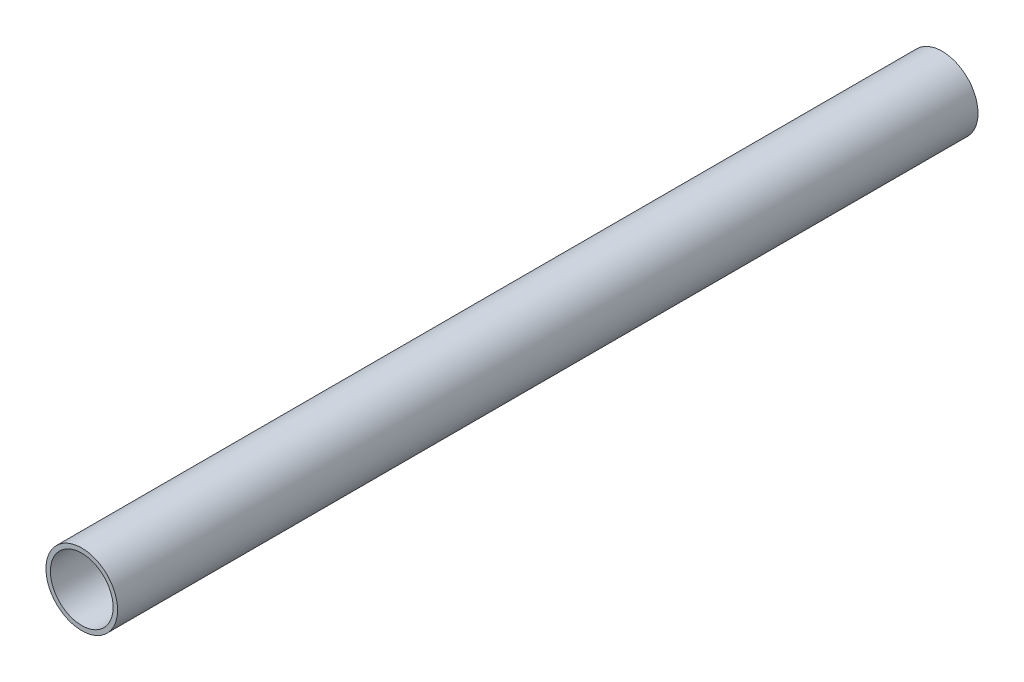
from build123d import *

# Parameters (mm, degrees)
SKETCH1_R           = 25.4
SKETCH1_R_2         = 22.225
BOSS_EXTRUDE1_DEPTH = 305.02479


with BuildPart() as part:
    # Sketch1 → Boss-Extrude1 (new, symmetric)
    with BuildSketch(Plane.XY):
        Circle(SKETCH1_R)
        Circle(SKETCH1_R_2, mode=Mode.SUBTRACT)
    extrude(amount=BOSS_EXTRUDE1_DEPTH, both=True)


solid = part.part
